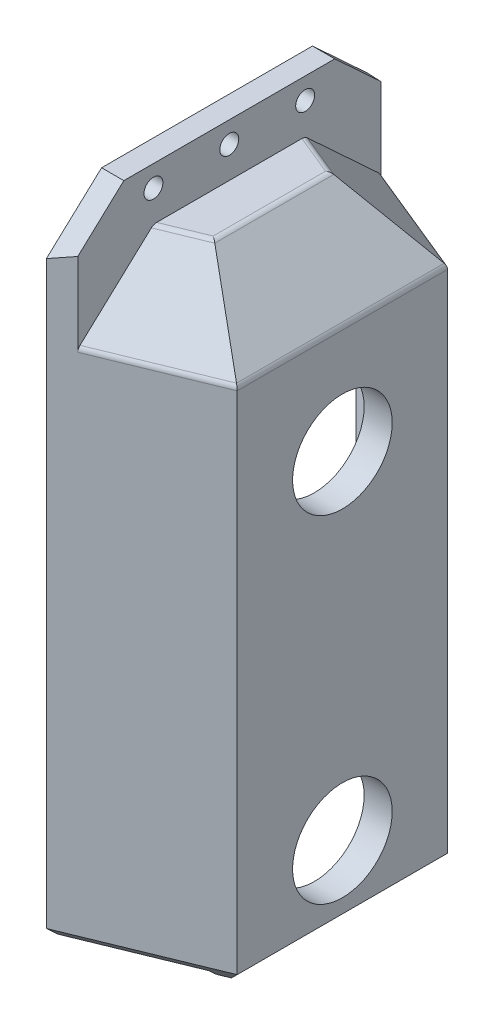
from build123d import *

# Parameters (mm, degrees)
SKETCH1_W            = 30
SKETCH1_H            = 5
BOSS_EXTRUDE1_DEPTH  = 19.3
SKETCH2_W            = 40
SKETCH2_H            = 10
BOSS_EXTRUDE2_DEPTH  = 3.175
SKETCH3_W            = 4
SKETCH3_H            = 30
BOSS_EXTRUDE3_DEPTH  = 75
CUT_EXTRUDE1_REACH   = 84.48
SKETCH4_R            = 7.1
BOSS_EXTRUDE7_DEPTH  = 5
BOSS_EXTRUDE8_DEPTH  = 5
CHAMFER1_SIZE        = 5
BOSS_EXTRUDE9_DEPTH  = 75
BOSS_EXTRUDE10_DEPTH = 5
CHAMFER2_SIZE        = 5
CHAMFER3_SIZE        = 10
BOSS_EXTRUDE15_DEPTH = 3.175
CUT_EXTRUDE2_DEPTH   = 81.759021382
FILLET6_R            = 1
FILLET7_R            = 1
CHAMFER6_SIZE        = 2.5
SKETCH16_R           = 1.35
CUT_EXTRUDE3_DEPTH   = 83.406281069


with BuildPart() as part:
    # Sketch1 → Boss-Extrude1 (new body)
    with BuildSketch(Plane(origin=(0, 0, 0), x_dir=(0, 0, -1), z_dir=(1, 0, 0))):
        Rectangle(SKETCH1_W, SKETCH1_H)
    extrude(amount=BOSS_EXTRUDE1_DEPTH)

    # Sketch2 → Boss-Extrude2 (add)
    with BuildSketch(Plane.ZY):
        with Locations((0.597390222, 2.5)):
            Rectangle(SKETCH2_W, SKETCH2_H)
    extrude(amount=-BOSS_EXTRUDE2_DEPTH)

    # Sketch3 → Boss-Extrude3 (add)
    with BuildSketch(Plane.XZ.offset(2.5)):
        with Locations((17.3, 0)):
            Rectangle(SKETCH3_W, SKETCH3_H)
    extrude(amount=BOSS_EXTRUDE3_DEPTH)

    # Sketch4 → Cut-Extrude1 (cut, up to next)
    with BuildSketch(Plane(origin=(19.3, 0, 0), x_dir=(0, 0, -1), z_dir=(1, 0, 0)), mode=Mode.PRIVATE) as cut_extrude1_sk1:
        with Locations((2.035e-06, -17.9)):
            Circle(SKETCH4_R)
    cut_extrude1_tool1 = extrude(cut_extrude1_sk1.sketch, amount=-CUT_EXTRUDE1_REACH, mode=Mode.PRIVATE) & part.part
    # Sketch4 → Cut-Extrude1 (cut, up to next)
    with BuildSketch(Plane(origin=(19.3, 0, 0), x_dir=(0, 0, -1), z_dir=(1, 0, 0)), mode=Mode.PRIVATE) as cut_extrude1_sk2:
        with Locations((-1.3e-07, -65.9)):
            Circle(SKETCH4_R)
    cut_extrude1_tool2 = extrude(cut_extrude1_sk2.sketch, amount=-CUT_EXTRUDE1_REACH, mode=Mode.PRIVATE) & part.part
    add(cut_extrude1_tool1.solids().sort_by_distance((19.3, -17.9, -2e-06))[0], mode=Mode.SUBTRACT)
    add(cut_extrude1_tool2.solids().sort_by_distance((19.3, -65.9, 0))[0], mode=Mode.SUBTRACT)

    # Sketch10 → Boss-Extrude7 (add)
    with BuildSketch(Plane(origin=(0, 2.5, 0), x_dir=(1, 0, 0), z_dir=(0, 1, 0))):
        Polygon((3.175, 19.402609778), (0, 19.402609778), (0, 22.902609778), (19.3, 15), (3.175, 15), align=None)
    boss_extrude7 = extrude(amount=-BOSS_EXTRUDE7_DEPTH)

    # Sketch11 → Boss-Extrude8 (add)
    with BuildSketch(Plane(origin=(0, 2.5, 0), x_dir=(1, 0, 0), z_dir=(0, 1, 0))):
        Polygon((0, 19.402609778), (0, 22.902609778), (3.175, 21.60256905), (3.175, 19.402609778), align=None)
    boss_extrude8 = extrude(amount=BOSS_EXTRUDE8_DEPTH)

    # Mirror2: Boss-Extrude7, Boss-Extrude8 across plane
    add(boss_extrude7.mirror(Plane(origin=(0, 0, 0), x_dir=(1, 0, 0), z_dir=(0, 0, -1))))
    add(boss_extrude8.mirror(Plane(origin=(0, 0, 0), x_dir=(1, 0, 0), z_dir=(0, 0, -1))))

    # Chamfer1
    chamfer1_edges = [part.edges().sort_by_distance(p)[0] for p in [
        (3.175, 2.5, 0),
    ]]
    chamfer(chamfer1_edges, length=CHAMFER1_SIZE - 0.0001)  # a hair under: the kernel refuses the full size

    # Sketch12 → Boss-Extrude9 (add)
    with BuildSketch(Plane.XZ.offset(2.5)):
        Polygon((0, -22.902609778), (19.3, -15), (15.3, -15), (0, -21.264763192), align=None)
        Polygon((0, 22.902609778), (19.3, 15), (15.3, 15), (0, 21.264763192), align=None)
    extrude(amount=BOSS_EXTRUDE9_DEPTH)

    # Sketch13 → Boss-Extrude10 (add)
    with BuildSketch(Plane(origin=(0, 2.5, 0), x_dir=(1, 0, 0), z_dir=(0, 1, 0))):
        Polygon((3.175, 21.60256905), (3.175, -21.60256905), (19.3, -15), (19.3, 15), align=None)
    extrude(amount=BOSS_EXTRUDE10_DEPTH)

    # Chamfer2
    chamfer2_edges = [part.edges().sort_by_distance(p)[0] for p in [
        (7.65, -2.5, -18.132381596),
        (7.65, -2.5, 18.132381596),
        (15.3, -2.5, 0),
    ]]
    chamfer(chamfer2_edges, length=CHAMFER2_SIZE)

    # Chamfer3
    chamfer3_edges = [part.edges().sort_by_distance(p)[0] for p in [
        (9.65, 7.5, 18.951304889),
        (19.3, 7.5, 0),
        (9.65, 7.5, -18.951304889),
    ]]
    chamfer(chamfer3_edges, length=CHAMFER3_SIZE)

    # Sketch14 → Boss-Extrude15 (add)
    with BuildSketch(Plane.ZY):
        Polygon((-22.902609778, -2.5), (-22.902609778, 7.718772797), (-15.034642071, 15), (15.034642071, 15), (22.902609778, 7.718772797), (22.902609778, -2.5), align=None)
    extrude(amount=-BOSS_EXTRUDE15_DEPTH)

    # Sketch15 → Cut-Extrude2 (cut, through all)
    with BuildSketch(Plane.XZ.offset(2.5)):
        Polygon((3.175, 22.902609778), (0, 22.902609778), (3.175, 21.60256905), align=None)
        Polygon((3.175, -22.902609778), (3.175, -21.60256905), (0, -22.902609778), align=None)
    extrude(amount=-CUT_EXTRUDE2_DEPTH, mode=Mode.SUBTRACT)

    # Fillet6
    fillet6_edges = [part.edges().sort_by_distance(p)[0] for p in [
        (9.3, 7.5, 0),
        (6.2375, 7.5, -9.542766367),
        (6.2375, 7.5, 9.542766367),
    ]]
    fillet(fillet6_edges, radius=FILLET6_R)

    # Fillet7
    fillet7_edges = [part.edges().sort_by_distance(p)[0] for p in [
        (11.2375, -2.5, 18.301284525),
        (19.3, -2.5, 0),
        (11.2375, -2.5, -18.301284525),
    ]]
    fillet(fillet7_edges, radius=FILLET7_R)

    # Chamfer6
    chamfer6_edges = [part.edges().sort_by_distance(p)[0] for p in [
        (9.65, -77.5, -18.951304889),
        (19.3, -77.5, 0),
        (9.65, -77.5, 18.951304889),
    ]]
    chamfer(chamfer6_edges, length=CHAMFER6_SIZE)

    # Sketch16 → Cut-Extrude3 (cut, through all)
    with BuildSketch(Plane(origin=(3.175, 0, 0), x_dir=(0, 0, -1), z_dir=(1, 0, 0))):
        with Locations((0, 11.960932583)):
            Circle(SKETCH16_R)
        with Locations((-10.818605561, 11.960932583)):
            Circle(SKETCH16_R)
        with Locations((10.818605561, 11.960932583)):
            Circle(SKETCH16_R)
    extrude(amount=-CUT_EXTRUDE3_DEPTH, mode=Mode.SUBTRACT)


solid = part.part
